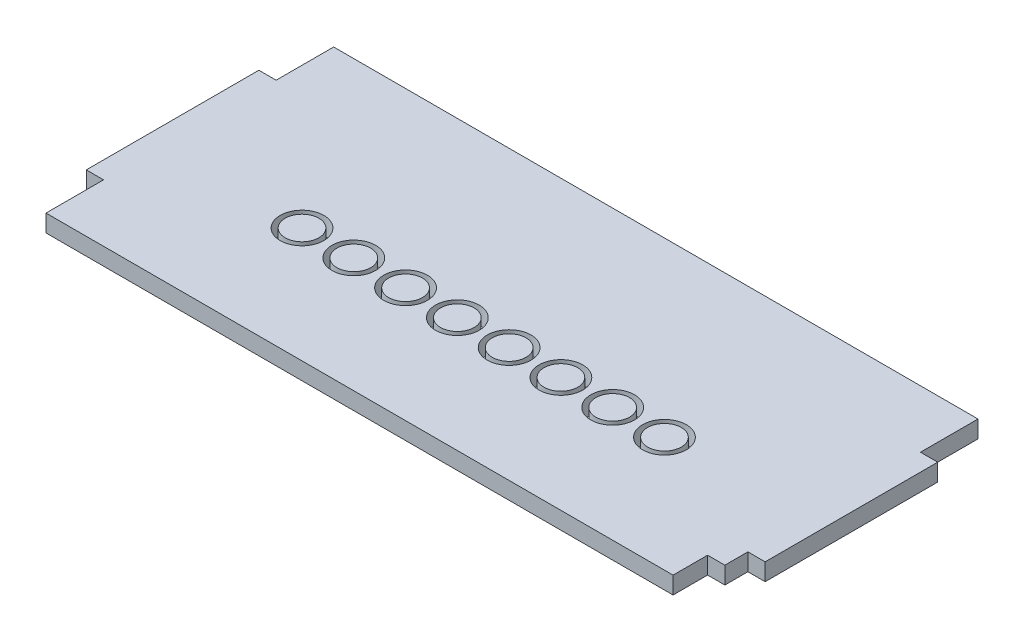
from build123d import *

# Parameters (mm, degrees)
LED_1_OUTLINE_R     = 2.25
LED_1_DEPTH         = 3
SKETCH_1_R          = 3.8
CUT_EXTRUDE_1_DEPTH = 3
SKETCH_3_R          = 2.934909796
EXTRUDE_1_DEPTH     = 3
EXTRUDE_1_2_DEPTH   = 3
EXTRUDE_1_3_DEPTH   = 3
EXTRUDE_1_4_DEPTH   = 3
EXTRUDE_1_5_DEPTH   = 3
EXTRUDE_1_6_DEPTH   = 3
EXTRUDE_1_7_DEPTH   = 3
EXTRUDE_1_8_DEPTH   = 3


# Read off the part's stored shape, not the designer's step: 基体零件-LED板-1
with BuildPart() as part:
    # 基体零件-LED板-1 outline → 基体零件-LED板-1 (new body)
    with BuildSketch(Plane(origin=(0, 0, 0), x_dir=(1, 0, 0), z_dir=(0, 1, 0))):
        Polygon((-3, -140), (0, -140), (0, -110), (-3, -110), (-3, -100), (-115, -100), (-115, -110), (-118, -110), (-118, -140), (-115, -140), (-115, -150), (-6.001970153, -150), (-6.001970153, -144), (-3, -144), align=None)
        with Locations((-90.5, -130)):
            Circle(LED_1_OUTLINE_R, mode=Mode.SUBTRACT)
        with Locations((-81.5, -130)):
            Circle(LED_1_OUTLINE_R, mode=Mode.SUBTRACT)
        with Locations((-72.5, -130)):
            Circle(LED_1_OUTLINE_R, mode=Mode.SUBTRACT)
        with Locations((-63.5, -130)):
            Circle(LED_1_OUTLINE_R, mode=Mode.SUBTRACT)
        with Locations((-54.5, -130)):
            Circle(LED_1_OUTLINE_R, mode=Mode.SUBTRACT)
        with Locations((-45.5, -130)):
            Circle(LED_1_OUTLINE_R, mode=Mode.SUBTRACT)
        with Locations((-36.5, -130)):
            Circle(LED_1_OUTLINE_R, mode=Mode.SUBTRACT)
        with Locations((-27.5, -130)):
            Circle(LED_1_OUTLINE_R, mode=Mode.SUBTRACT)
    extrude(amount=LED_1_DEPTH)

    # 草图1 → 切除-拉伸1 (cut)
    with BuildSketch(Plane(origin=(0, 3, 0), x_dir=(1, 0, 0), z_dir=(0, 1, 0))):
        with Locations(Location((-90.5, -130, 0), (0, 0, 270))):
            Circle(SKETCH_1_R)
        with Locations(Location((-81.5, -130, 0), (0, 0, 270))):
            Circle(SKETCH_1_R)
        with Locations(Location((-72.5, -130, 0), (0, 0, 270))):
            Circle(SKETCH_1_R)
        with Locations(Location((-63.5, -130, 0), (0, 0, 270))):
            Circle(SKETCH_1_R)
        with Locations(Location((-54.5, -130, 0), (0, 0, 270))):
            Circle(SKETCH_1_R)
        with Locations(Location((-45.5, -130, 0), (0, 0, 270))):
            Circle(SKETCH_1_R)
        with Locations(Location((-36.5, -130, 0), (0, 0, 270))):
            Circle(SKETCH_1_R)
        with Locations(Location((-27.5, -130, 0), (0, 0, 270))):
            Circle(SKETCH_1_R)
    extrude(amount=-CUT_EXTRUDE_1_DEPTH, mode=Mode.SUBTRACT)


with BuildPart() as body_2:
    # 草图3 → 凸台-拉伸1 (new body)
    with BuildSketch(Plane(origin=(0, 3, 0), x_dir=(1, 0, 0), z_dir=(0, 1, 0))):
        with Locations(Location((-27.5, -130, 0), (0, 0, 270))):
            Circle(SKETCH_3_R)
    extrude(amount=-EXTRUDE_1_DEPTH)


with BuildPart() as body_3:
    # 草图3 → Extrude 1 2 (new body)
    with BuildSketch(Plane(origin=(0, 3, 0), x_dir=(1, 0, 0), z_dir=(0, 1, 0))):
        with Locations(Location((-36.5, -130, 0), (0, 0, 270))):
            Circle(SKETCH_3_R)
    extrude(amount=-EXTRUDE_1_2_DEPTH)


with BuildPart() as body_4:
    # 草图3 → Extrude 1 3 (new body)
    with BuildSketch(Plane(origin=(0, 3, 0), x_dir=(1, 0, 0), z_dir=(0, 1, 0))):
        with Locations(Location((-45.5, -130, 0), (0, 0, 270))):
            Circle(SKETCH_3_R)
    extrude(amount=-EXTRUDE_1_3_DEPTH)


with BuildPart() as body_5:
    # 草图3 → Extrude 1 4 (new body)
    with BuildSketch(Plane(origin=(0, 3, 0), x_dir=(1, 0, 0), z_dir=(0, 1, 0))):
        with Locations(Location((-54.5, -130, 0), (0, 0, 270))):
            Circle(SKETCH_3_R)
    extrude(amount=-EXTRUDE_1_4_DEPTH)


with BuildPart() as body_6:
    # 草图3 → Extrude 1 5 (new body)
    with BuildSketch(Plane(origin=(0, 3, 0), x_dir=(1, 0, 0), z_dir=(0, 1, 0))):
        with Locations(Location((-63.5, -130, 0), (0, 0, 270))):
            Circle(SKETCH_3_R)
    extrude(amount=-EXTRUDE_1_5_DEPTH)


with BuildPart() as body_7:
    # 草图3 → Extrude 1 6 (new body)
    with BuildSketch(Plane(origin=(0, 3, 0), x_dir=(1, 0, 0), z_dir=(0, 1, 0))):
        with Locations(Location((-72.5, -130, 0), (0, 0, 270))):
            Circle(SKETCH_3_R)
    extrude(amount=-EXTRUDE_1_6_DEPTH)


with BuildPart() as body_8:
    # 草图3 → Extrude 1 7 (new body)
    with BuildSketch(Plane(origin=(0, 3, 0), x_dir=(1, 0, 0), z_dir=(0, 1, 0))):
        with Locations(Location((-81.5, -130, 0), (0, 0, 270))):
            Circle(SKETCH_3_R)
    extrude(amount=-EXTRUDE_1_7_DEPTH)


with BuildPart() as body_9:
    # 草图3 → Extrude 1 8 (new body)
    with BuildSketch(Plane(origin=(0, 3, 0), x_dir=(1, 0, 0), z_dir=(0, 1, 0))):
        with Locations(Location((-90.5, -130, 0), (0, 0, 270))):
            Circle(SKETCH_3_R)
    extrude(amount=-EXTRUDE_1_8_DEPTH)


solid = Compound([part.part, body_2.part, body_3.part, body_4.part, body_5.part, body_6.part, body_7.part, body_8.part, body_9.part])
